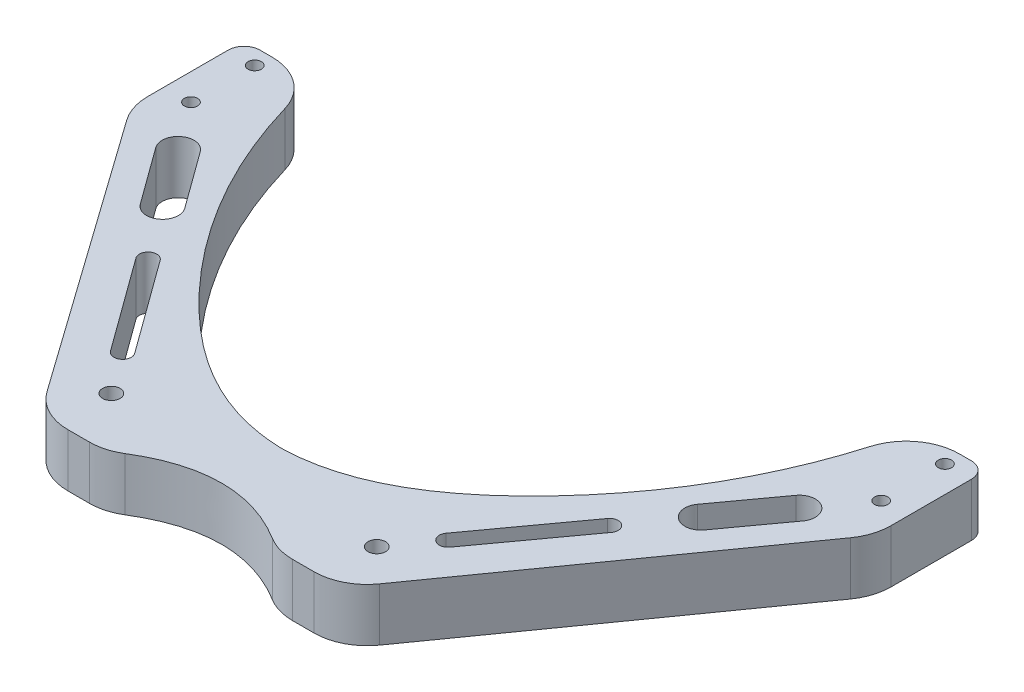
from build123d import *

# Parameters (mm, degrees)
SKETCH_1_W          = 140
SKETCH_1_H          = 80
SKETCH_1_R          = 1.25
SKETCH_1_R_2        = 1.65
EXTRUDE_1_DEPTH     = 10
CUT_EXTRUDE_1_DEPTH = 101.204790305
FILLET_1_R          = 10
FILLET_2_R          = 3
CUT_EXTRUDE_2_DEPTH = 101.204790455


with BuildPart() as part:
    # 草图1 → 凸台-拉伸1 (new body)
    with BuildSketch(Plane(origin=(0, 0, 0), x_dir=(1, 0, 0), z_dir=(0, 1, 0))):
        with Locations((0, -31)):
            Rectangle(SKETCH_1_W, SKETCH_1_H)
        with Locations(Location((-65, 6, 0), (0, 0, 270))):
            Circle(SKETCH_1_R, mode=Mode.SUBTRACT)
        with Locations(Location((-65, -6, 0), (0, 0, 270))):
            Circle(SKETCH_1_R, mode=Mode.SUBTRACT)
        with Locations(Location((65, -6, 0), (0, 0, 90))):
            Circle(SKETCH_1_R, mode=Mode.SUBTRACT)
        with Locations(Location((65, 6, 0), (0, 0, 90))):
            Circle(SKETCH_1_R, mode=Mode.SUBTRACT)
        with Locations(Location((-25, -61, 0), (0, 0, 270))):
            Circle(SKETCH_1_R_2, mode=Mode.SUBTRACT)
        with Locations(Location((25, -61, 0), (0, 0, 90))):
            Circle(SKETCH_1_R_2, mode=Mode.SUBTRACT)
    extrude(amount=EXTRUDE_1_DEPTH)

    # 草图2 → 切除-拉伸1 (cut, through all)
    with BuildSketch(Plane(origin=(0, 10, 0), x_dir=(1, 0, 0), z_dir=(0, 1, 0))):
        Polygon((-70, -12.331865366), (-28.346020761, -71), (-70, -71), align=None)
        Polygon((70, -12.331865366), (28.346020761, -71), (70, -71), align=None)
        with BuildLine():
            Line((-16.105693614, -71), (16.105693614, -71))
            add(Edge.make_bspline(
                [(-16.105693614, -71), (0, -59.46206609), (16.105693614, -71)],
                knots=[0, 0, 0, 1, 1, 1], degree=2))
        make_face()
        with BuildLine():
            Line((56.906784104, 9), (-56.906784104, 9))
            add(Edge.make_bspline(
                [(-56.906784104, 9), (-53.268076424, -8.599244087), (-38.630052836, -35.640481439), (-12.875691634, -53.653343186), (0, -53.936278292)],
                knots=[0, 0, 0, 0, 0.590583246, 1, 1, 1, 1], degree=3))
            add(Edge.make_bspline(
                [(56.906784104, 9), (53.268076424, -8.599244087), (38.630052836, -35.640481439), (12.875691634, -53.653343186), (0, -53.936278292)],
                knots=[0, 0, 0, 0, 0.590583246, 1, 1, 1, 1], degree=3))
        make_face()
    extrude(amount=-CUT_EXTRUDE_1_DEPTH, mode=Mode.SUBTRACT)

    # 圆角1
    # the kernel refuses this fillet: 10 mm, written as the material it adds along each edge
    with BuildSketch(Plane(origin=(0, 10, 53.936278292), x_dir=(-0.999651568741567, 0, -0.026395854078324985), z_dir=(0, -1, 0))) as fillet_1_piece_1:
        with BuildLine():
            CenterArc((0.264047953, 9.999901848), FILLET_1_R, 266.721049901, 3.532806773)
            Line((-0.307924469, 0.016272871), (-0.319363918, -0.183399709))
            ThreePointArc((-0.319363918, -0.183399709), (-0.16453479, -0.191925855), (-0.009670177, -0.199766082))
            Line((-0.009670177, -0.199766082), (-0.000885616, -0.199998039))
            ThreePointArc((-0.000885616, -0.199998039), (0.15417695, -0.200341456), (0.30924028, -0.199998037))
            Line((0.30924028, -0.199998037), (0.308354155, 0))
        make_face()
    extrude(amount=10)
    # the kernel refuses this fillet: 10 mm, written as the material it takes off along each edge
    with BuildSketch(Plane(origin=(-70, 10, 12.331865366), x_dir=(0.5789182566890616, 0, 0.8153855849057535), z_dir=(0, -1, 0)), Plane(origin=(70, 10, 12.331865366), x_dir=(0, 0, -1), z_dir=(0, -1, 0))) as fillet_1_2_piece_1:
        with BuildLine():
            CenterArc((FILLET_1_R * 0.318895479562, -FILLET_1_R), FILLET_1_R, 90, 35.374494493)
            Line((-FILLET_1_R * 0.260022777127, -FILLET_1_R * 0.184614415094), (-FILLET_1_R * 0.271601142261, -FILLET_1_R * 0.168306703396))
            Line((-FILLET_1_R * 0.271601142261, -FILLET_1_R * 0.168306703396), (-FILLET_1_R * 0.00637790959125, FILLET_1_R * 0.02))
            Line((-FILLET_1_R * 0.00637790959125, FILLET_1_R * 0.02), (FILLET_1_R * 0.318895479562, FILLET_1_R * 0.02))
            Line((FILLET_1_R * 0.318895479562, FILLET_1_R * 0.02), (FILLET_1_R * 0.318895479562, 0))
        make_face()
    extrude(amount=10, mode=Mode.SUBTRACT)
    with BuildSketch(Plane(origin=(-56.906784104, 10, -9), x_dir=(-1, 0, 0), z_dir=(0, -1, 0))) as fillet_1_2_piece_2:
        with BuildLine():
            CenterArc((7.807317394, -10), FILLET_1_R, 90, 73.718330192)
            Line((-1.79163295, -7.196403685), (-1.983611957, -7.140331758))
            ThreePointArc((-1.983611957, -7.140331758), (-1.017653275, -3.56787057), (-0.195857636, 0.040494278))
            Line((-0.195857636, 0.040494278), (0, 0.2))
            Line((0, 0.2), (7.807317394, 0.2))
            Line((7.807317394, 0.2), (7.807317394, 0))
        make_face()
    extrude(amount=10, mode=Mode.SUBTRACT)
    with BuildSketch(Plane(origin=(56.906784104, 10, -9), x_dir=(-0.2415877467248244, 0, 0.9703789778392884), z_dir=(0, -1, 0))) as fillet_1_2_piece_3:
        with BuildLine():
            CenterArc((7.817637561, -9.991934139), FILLET_1_R, 92.301400389, 73.718330192)
            Line((-1.886152217, -7.576056672), (-2.080228013, -7.527739123))
            Line((-2.080228013, -7.527739123), (-0.194075796, 0.048317549))
            Line((-0.194075796, 0.048317549), (0.008022009, 0.199839054))
            ThreePointArc((0.008022009, 0.199839054), (3.708039158, 0.125555533), (7.408044176, 0.199838683))
            Line((7.408044176, 0.199838683), (7.416075419, 0))
        make_face()
    extrude(amount=10, mode=Mode.SUBTRACT)
    with BuildSketch(Plane(origin=(-28.346020761, 10, 71), x_dir=(1, 0, 0), z_dir=(0, -1, 0)), Plane(origin=(28.346020761, 10, 71), x_dir=(0.5789182566890612, 0, -0.8153855849057537), z_dir=(0, -1, 0))) as fillet_1_2_piece_4:
        with BuildLine():
            CenterArc((FILLET_1_R * 0.516420391905, -FILLET_1_R), FILLET_1_R, 90, 54.625505507)
            Line((-FILLET_1_R * 0.298965193, -FILLET_1_R * 0.421081743311), (-FILLET_1_R * 0.315272904699, -FILLET_1_R * 0.409503378177))
            Line((-FILLET_1_R * 0.315272904699, -FILLET_1_R * 0.409503378177), (-FILLET_1_R * 0.0103284078381, FILLET_1_R * 0.02))
            Line((-FILLET_1_R * 0.0103284078381, FILLET_1_R * 0.02), (FILLET_1_R * 0.516420391905, FILLET_1_R * 0.02))
            Line((FILLET_1_R * 0.516420391905, FILLET_1_R * 0.02), (FILLET_1_R * 0.516420391905, 0))
        make_face()
    extrude(amount=10, mode=Mode.SUBTRACT)
    with BuildSketch(Plane(origin=(-16.105693614, 10, 71), x_dir=(-1, 0, 0), z_dir=(0, -1, 0))) as fillet_1_2_piece_5:
        with BuildLine():
            CenterArc((3.016711089, 10), FILLET_1_R, 238.325124011, 31.674875989)
            Line((-2.234274138, 1.489585548), (-2.339293843, 1.319377259))
            ThreePointArc((-2.339293843, 1.319377259), (-1.215329893, 0.597636236), (-0.116473908, -0.162584835))
            Line((-0.116473908, -0.162584835), (0, -0.2))
            Line((0, -0.2), (3.016711089, -0.2))
            Line((3.016711089, -0.2), (3.016711089, 0))
        make_face()
    extrude(amount=10, mode=Mode.SUBTRACT)
    with BuildSketch(Plane(origin=(16.105693614, 10, 71), x_dir=(-0.8320383563974485, 0, -0.554718102718338), z_dir=(0, -1, 0))) as fillet_1_2_piece_6:
        with BuildLine():
            CenterArc((3.037161691, 9.993807815), FILLET_1_R, 236.308699407, 31.674875989)
            Line((-2.510019336, 1.673424251), (-2.620962956, 1.50701658))
            Line((-2.620962956, 1.50701658), (-0.110943621, -0.166407671))
            Line((-0.110943621, -0.166407671), (0.006722008, -0.199887005))
            ThreePointArc((0.006722008, -0.199887005), (1.342720726, -0.176909221), (2.678264654, -0.199876156))
            Line((2.678264654, -0.199876156), (2.685301851, 0))
        make_face()
    extrude(amount=10, mode=Mode.SUBTRACT)

    # 圆角2
    fillet_2_edges = [part.edges().sort_by_distance(p)[0] for p in [
        (-70, 5, -9),
        (70, 5, -9),
    ]]
    fillet(fillet_2_edges, radius=FILLET_2_R)

    # 草图3 → 切除-拉伸2 (cut, through all)
    with BuildSketch(Plane(origin=(0, 10, 0), x_dir=(1, 0, 0), z_dir=(0, 1, 0))):
        with BuildLine():
            Line((29.324357242, -52.277909179), (42.133187381, -34.665767738))
            ThreePointArc((42.133187381, -34.665767738), (44.414090847, -34.305625086), (44.774233499, -36.586528552))
            Line((44.774233499, -36.586528552), (31.965403361, -54.198669993))
            ThreePointArc((31.965403361, -54.198669993), (29.684499894, -54.558812645), (29.324357242, -52.277909179))
        make_face()
        with BuildLine():
            Line((60.93603818, -16.688498943), (53.122046102, -27.432738051))
            ThreePointArc((53.122046102, -27.432738051), (48.931322756, -28.09443121), (48.269629596, -23.903707865))
            Line((48.269629596, -23.903707865), (56.083621674, -13.159468757))
            ThreePointArc((56.083621674, -13.159468757), (60.27434502, -12.497775597), (60.93603818, -16.688498943))
        make_face()
        with BuildLine():
            Line((-60.93603818, -16.688498943), (-53.122046102, -27.432738051))
            ThreePointArc((-53.122046102, -27.432738051), (-48.931322756, -28.09443121), (-48.269629596, -23.903707865))
            Line((-48.269629596, -23.903707865), (-56.083621674, -13.159468757))
            ThreePointArc((-56.083621674, -13.159468757), (-60.27434502, -12.497775597), (-60.93603818, -16.688498943))
        make_face()
        with BuildLine():
            Line((-29.324357242, -52.277909179), (-42.133187381, -34.665767738))
            ThreePointArc((-42.133187381, -34.665767738), (-44.414090847, -34.305625086), (-44.774233499, -36.586528552))
            Line((-44.774233499, -36.586528552), (-31.965403361, -54.198669993))
            ThreePointArc((-31.965403361, -54.198669993), (-29.684499894, -54.558812645), (-29.324357242, -52.277909179))
        make_face()
    extrude(amount=-CUT_EXTRUDE_2_DEPTH, mode=Mode.SUBTRACT)


solid = part.part
